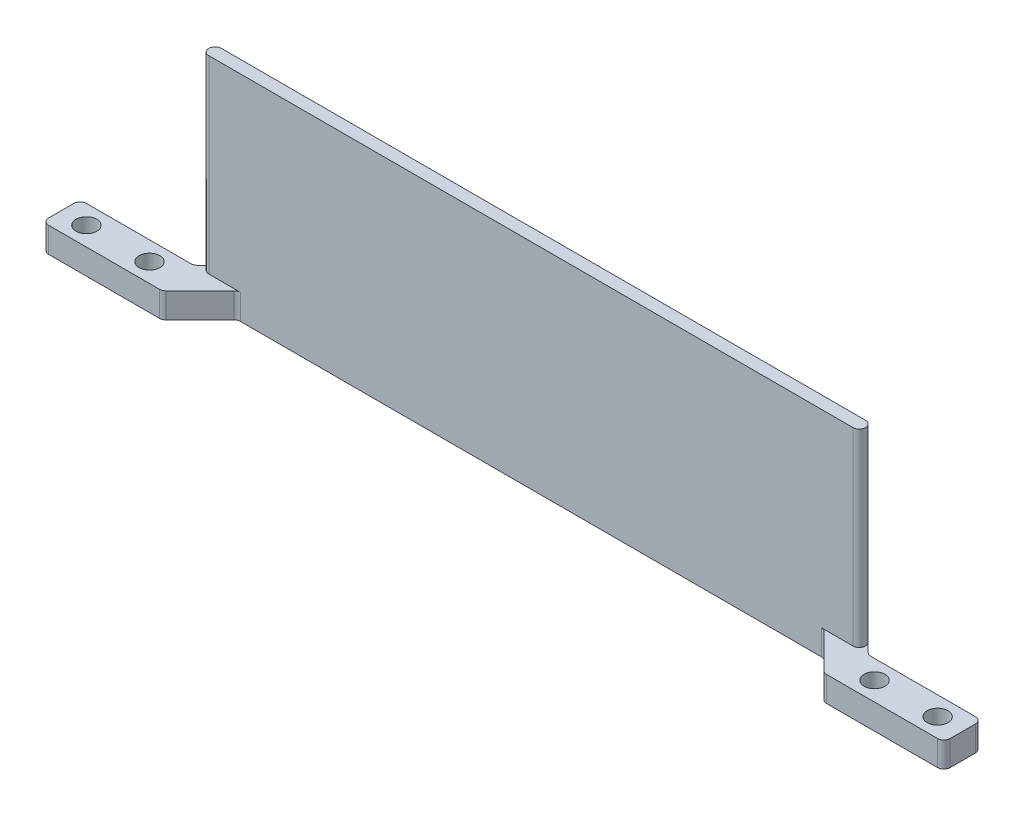
from build123d import *

# Parameters (mm, degrees)
SKETCH_1_R      = 1.65
EXTRUDE_1_DEPTH = 4
EXTRUDE_2_DEPTH = 30
FILLET_1_R      = 1
FILLET_2_R      = 1


with BuildPart() as part:
    # 草图1 → 凸台-拉伸1 (new body)
    with BuildSketch(Plane(origin=(0, 0, 0), x_dir=(1, 0, 0), z_dir=(0, 1, 0))):
        Polygon((-71.5, 3), (-71.5, -3), (-52.5, -3), (-46.5, 3), (46.5, 3), (52.5, -3), (71.5, -3), (71.5, 3), (53.5, 3), (51.5, 5), (-51.5, 5), (-53.5, 3), align=None)
        with Locations(Location((-57.5, 0, 0), (0, 0, 270))):
            Circle(SKETCH_1_R, mode=Mode.SUBTRACT)
        with Locations(Location((-67.5, 0, 0), (0, 0, 270))):
            Circle(SKETCH_1_R, mode=Mode.SUBTRACT)
        with Locations(Location((67.5, 0, 0), (0, 0, 90))):
            Circle(SKETCH_1_R, mode=Mode.SUBTRACT)
        with Locations(Location((57.5, 0, 0), (0, 0, 90))):
            Circle(SKETCH_1_R, mode=Mode.SUBTRACT)
    extrude(amount=EXTRUDE_1_DEPTH)

    # 草图2 → 凸台-拉伸2 (add)
    with BuildSketch(Plane(origin=(0, 4, 0), x_dir=(1, 0, 0), z_dir=(0, 1, 0))):
        Polygon((-51.5, 5), (-53.5, 3), (53.5, 3), (51.5, 5), align=None)
    extrude(amount=EXTRUDE_2_DEPTH)

    # 圆角1
    fillet_1_edges = [part.edges().sort_by_distance(p)[0] for p in [
        (51.5, 17, -5),
        (-51.5, 17, -5),
        (-71.5, 2, -3),
        (-71.5, 2, 3),
        (-46.5, 2, -3),
        (46.5, 2, -3),
        (52.5, 2, 3),
        (71.5, 2, 3),
        (71.5, 2, -3),
        (-52.5, 2, 3),
        (-53.5, 19, -3),
        (53.5, 19, -3),
    ]]
    fillet(fillet_1_edges, radius=FILLET_1_R - 0.0001)  # a hair under: the kernel refuses the full size

    # 圆角2
    fillet_2_edges = [part.edges().sort_by_distance(p)[0] for p in [
        (53.5, 2, -3),
        (-53.5, 2, -3),
    ]]
    fillet(fillet_2_edges, radius=FILLET_2_R)


solid = part.part
